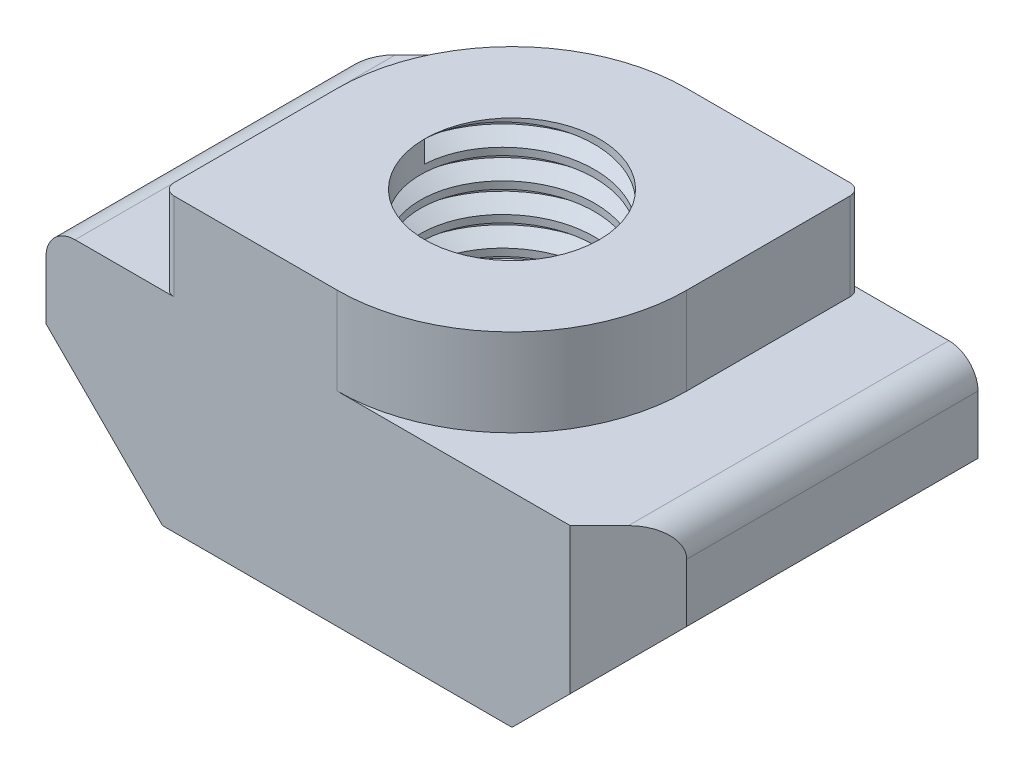
from build123d import *

# Parameters (mm, degrees)
BOSS_EXTRUDE1_DEPTH = 3.5
SKETCH2_R           = 3
BOSS_EXTRUDE2_DEPTH = 1.5
CUT_EXTRUDE1_REACH  = 9.681
SKETCH3_R           = 1.5
THREAD1_PITCH       = 0.5
CHAMFER1_SIZE       = 2
FILLET1_R           = 0.5


with BuildPart() as part:
    # Sketch1 → Boss-Extrude1 (new body)
    with BuildSketch(Plane(origin=(0, 0, 0), x_dir=(1, 0, 0), z_dir=(0, 1, 0))):
        Polygon((-5, 2), (-4, 3), (5, 3), (5, -2), (4, -3), (-5, -3), align=None)
    extrude(amount=BOSS_EXTRUDE1_DEPTH)

    # Sketch2 → Boss-Extrude2 (add)
    with BuildSketch(Plane(origin=(0, 3.5, 0), x_dir=(1, 0, 0), z_dir=(0, 1, 0))):
        with BuildLine():
            ThreePointArc((0, -3), (-2.121320344, -2.121320344), (-3, 0))
            Line((-3, 0), (-3, -2.8))
            ThreePointArc((-3, -2.8), (-2.941421356, -2.941421356), (-2.8, -3))
            Line((-2.8, -3), (0, -3))
        make_face()
        Circle(SKETCH2_R)
        with BuildLine():
            Line((2.8, 3), (0, 3))
            ThreePointArc((0, 3), (2.121320344, 2.121320344), (3, 0))
            Line((3, 0), (3, 2.8))
            ThreePointArc((3, 2.8), (2.941421356, 2.941421356), (2.8, 3))
        make_face()
    extrude(amount=BOSS_EXTRUDE2_DEPTH)

    # Sketch3 → Cut-Extrude1 (cut, up to next)
    with BuildSketch(Plane(origin=(0, 5, 0), x_dir=(1, 0, 0), z_dir=(0, 1, 0)), mode=Mode.PRIVATE) as cut_extrude1_sk1:
        with Locations(Location((0, 0, 0), (0, 0, 270))):
            Circle(SKETCH3_R)
    cut_extrude1_tool1 = extrude(cut_extrude1_sk1.sketch, amount=-CUT_EXTRUDE1_REACH, mode=Mode.PRIVATE) & part.part
    add(cut_extrude1_tool1.solids().sort_by_distance((0, 5, 0))[0], mode=Mode.SUBTRACT)

    # Thread1: the profile of Thread Profile1 profile screwed along a right-hand helix of 10 turns, 6 arcs to a turn; built about Z, then put on its axis
    thread1_z = Axis((0, 0, 0), (0, 0, 1))
    thread1_corners = [(1.4997, 0, -0.000173205), (1.770632938, 0, 0.156249999), (1.770632938, 0, 0.218749999), (1.4997, 0, 0.375173204)]
    with BuildLine(mode=Mode.PRIVATE) as thread1_profile:
        Line(thread1_corners[0], thread1_corners[1])
        Line(thread1_corners[1], thread1_corners[2])
        Line(thread1_corners[2], thread1_corners[3])
        Line(thread1_corners[3], thread1_corners[0])
    thread1_cap = Face(thread1_profile.wire())
    thread1_turn_angles = [0, 30, 60, 90, 120, 150, 180, 210, 240, 270, 300, 330, 360]
    thread1_turn_weights = [1, 0.8660254037844387, 1, 0.8660254037844387, 1, 0.8660254037844387, 1, 0.8660254037844387, 1, 0.8660254037844387, 1, 0.8660254037844387, 1]
    thread1_turn_rails = [Edge.make_bspline([Vector(p[0], p[1], 0).rotate(thread1_z, thread1_turn_angles[k]) / thread1_turn_weights[k] + Vector(0, 0, p[2] + THREAD1_PITCH * thread1_turn_angles[k] / 360) for k in range(13)], [0, 0, 0, 1, 1, 2, 2, 3, 3, 4, 4, 5, 5, 6, 6, 6], 2, thread1_turn_weights) for p in thread1_corners]
    thread1_turn_sides = [Face.make_surface_from_curves(thread1_turn_rails[p[0]], thread1_turn_rails[p[1]]) for p in [(0, 1), (1, 2), (2, 3), (3, 0)]]
    thread1 = Plane(origin=(0, 5, 0), x_dir=(-1, 0, 0), z_dir=(0, -1, 0)) * Solid(Shell([*[p.moved(Location((0, 0, THREAD1_PITCH * i))) for i in range(10) for p in thread1_turn_sides], thread1_cap, thread1_cap.rotate(thread1_z, 3600).moved(Location((0, 0, THREAD1_PITCH * 3600 / 360)))]))
    add(thread1, mode=Mode.SUBTRACT)

    # Chamfer1
    chamfer1_edges = [part.edges().sort_by_distance(p)[0] for p in [
        (5, 0, -0.5),
        (-5, 0, 0.5),
    ]]
    chamfer(chamfer1_edges, length=CHAMFER1_SIZE)

    # Fillet1
    fillet1_edges = [part.edges().sort_by_distance(p)[0] for p in [
        (-5, 3.5, 0.5),
        (5, 3.5, -0.5),
    ]]
    fillet(fillet1_edges, radius=FILLET1_R)


solid = part.part
